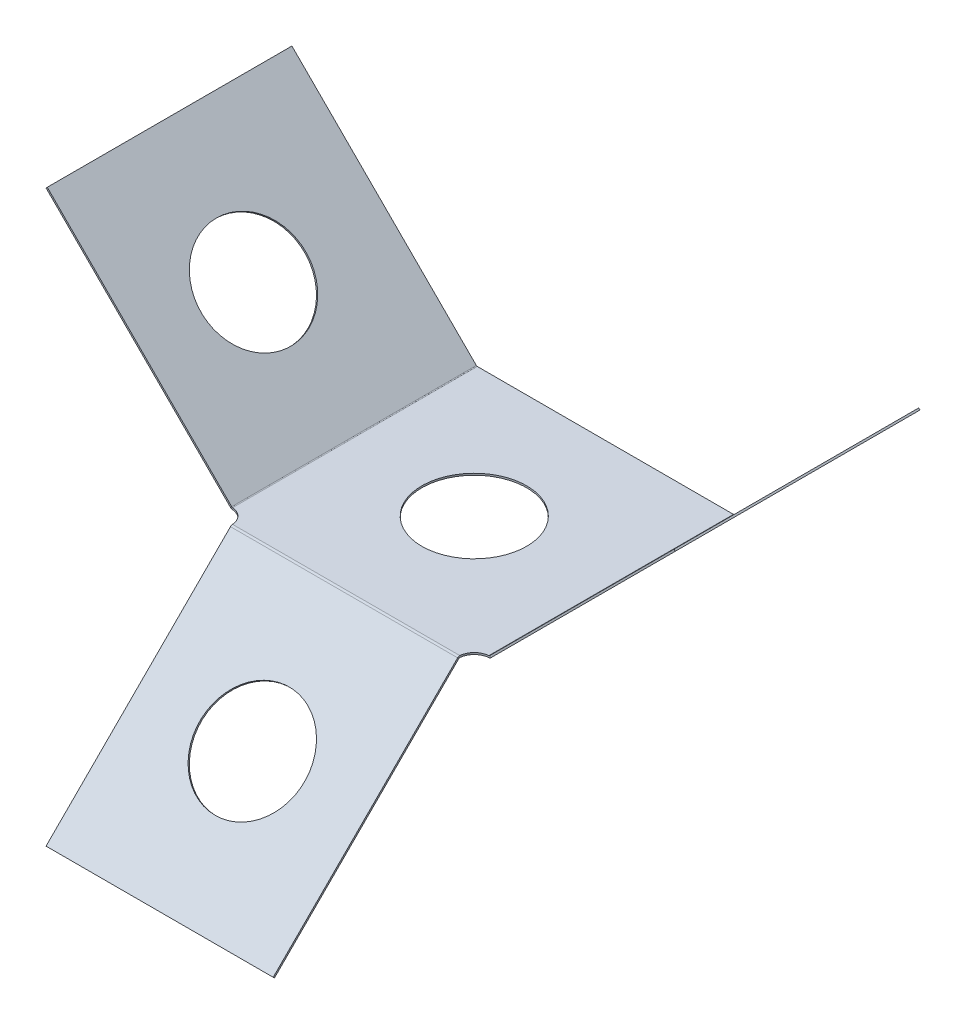
from build123d import *

# Parameters (mm, degrees)
SKETCH1_R            = 30
BASE_FLANGE1_DEPTH   = 1
EDGE_FLANGE1_START   = -75
EDGE_FLANGE1_DEPTH   = 140.5
EDGE_FLANGE1_START_2 = 65
EDGE_FLANGE1_2_DEPTH = 0.5
EDGE_FLANGE1_3_DEPTH = 140
SKETCH12_R           = 30
CUT_EXTRUDE1_DEPTH   = 10
EDGE_FLANGE2_START   = -65.5
EDGE_FLANGE2_DEPTH   = 131
EDGE_FLANGE2_2_DEPTH = 0.5
EDGE_FLANGE2_START_2 = 65
EDGE_FLANGE2_3_DEPTH = 0.5
EDGE_FLANGE2_START_3 = -65
EDGE_FLANGE2_4_DEPTH = 130
SKETCH16_R           = 30
CUT_EXTRUDE2_DEPTH   = 10
CUT_EXTRUDE3_DEPTH   = 10
FILLET2_R            = 9


# Read off the part's stored shape, not the designer's step: Edge-Flange1, Edge-Flange2
# Sheet-metal steps are written as plain solids
with BuildPart() as part:
    # Sketch1 → Base-Flange1 (new body)
    with BuildSketch(Plane(origin=(0, 0, 0), x_dir=(1, 0, 0), z_dir=(0, 1, 0))):
        with BuildLine():
            Line((-75, -65), (-75, 75))
            Line((-75, 75), (75, 75))
            Line((75, 75), (75, -65))
            ThreePointArc((75, -65), (72.071067812, -72.071067812), (65, -75))
            Line((65, -75), (-65, -75))
            ThreePointArc((-65, -75), (-72.071067812, -72.071067812), (-75, -65))
        make_face()
        with Locations(Location((0, 0, 0), (0, 0, 270))):
            Circle(SKETCH1_R, mode=Mode.SUBTRACT)
    extrude(amount=-BASE_FLANGE1_DEPTH)

    # Edge-Flange1 outline → Edge-Flange1 (cut)
    with BuildSketch(Plane.XY.offset(EDGE_FLANGE1_START)):
        with BuildLine():
            Line((-75, -1), (-73.279268401, -1))
            ThreePointArc((-73.279268401, -1), (-73.945137574, -0.867550387), (-74.509634201, -0.490365799))
            Line((-74.509634201, -0.490365799), (-75, 0))
            Line((-75, 0), (-75, -1))
        make_face()
        with BuildLine():
            ThreePointArc((74.509634201, -0.490365799), (73.945137574, -0.867550387), (73.279268401, -1))
            Line((73.279268401, -1), (75, -1))
            Line((75, -1), (75, 0))
            Line((75, 0), (74.509634201, -0.490365799))
        make_face()
    extrude(amount=EDGE_FLANGE1_DEPTH, mode=Mode.SUBTRACT)

    # Edge-Flange1 2 outline → Edge-Flange1 2 (cut)
    with BuildSketch(Plane.XY.offset(EDGE_FLANGE1_START_2)):
        with BuildLine():
            Line((-72.779268401, -1), (-72.779268401, 0))
            Line((-72.779268401, 0), (-75, 0))
            Line((-75, 0), (-74.509634201, -0.490365799))
            ThreePointArc((-74.509634201, -0.490365799), (-73.945137574, -0.867550387), (-73.279268401, -1))
            Line((-73.279268401, -1), (-72.779268401, -1))
        make_face()
        with BuildLine():
            Line((75, 0), (72.779268401, 0))
            Line((72.779268401, 0), (72.779268401, -1))
            Line((72.779268401, -1), (73.279268401, -1))
            ThreePointArc((73.279268401, -1), (73.945137574, -0.867550387), (74.509634201, -0.490365799))
            Line((74.509634201, -0.490365799), (75, 0))
        make_face()
    extrude(amount=EDGE_FLANGE1_2_DEPTH, mode=Mode.SUBTRACT)

    # Edge-Flange1 3 outline → Edge-Flange1 3 (add)
    with BuildSketch(Plane.XY.offset(EDGE_FLANGE1_START)):
        with BuildLine():
            Line((-75, 0), (-73.279268401, 0))
            ThreePointArc((-73.279268401, 0), (-73.562454141, 0.056329146), (-73.80252742, 0.216740982))
            Line((-73.80252742, 0.216740982), (-179.358910397, 105.773123959))
            Line((-179.358910397, 105.773123959), (-180.066017178, 105.066017178))
            Line((-180.066017178, 105.066017178), (-75, 0))
        make_face()
        with BuildLine():
            ThreePointArc((73.80252742, 0.216740982), (73.562454141, 0.056329146), (73.279268401, 0))
            Line((73.279268401, 0), (75, 0))
            Line((75, 0), (180.066017178, 105.066017178))
            Line((180.066017178, 105.066017178), (179.358910397, 105.773123959))
            Line((179.358910397, 105.773123959), (73.80252742, 0.216740982))
        make_face()
    extrude(amount=EDGE_FLANGE1_3_DEPTH)

    # Sketch12 → Cut-Extrude1 (cut)
    with BuildSketch(Plane(origin=(-36.792893219, -36.792893219, 0), x_dir=(0, 0, -1), z_dir=(0.7071067811865438, 0.7071067811865512, 0))):
        with Locations(Location((0, 126.618795027, 0), (0, 0, 90))):
            Circle(SKETCH12_R)
    cut_extrude1 = extrude(amount=-CUT_EXTRUDE1_DEPTH, mode=Mode.SUBTRACT)

    # Mirror1: Cut-Extrude1 across plane
    add(cut_extrude1.mirror(Plane(origin=(0, 0, 0), x_dir=(0, 0, 1), z_dir=(1, 0, 0))), mode=Mode.SUBTRACT)

    # Edge-Flange2 outline → Edge-Flange2 (cut)
    with BuildSketch(Plane.YZ.offset(EDGE_FLANGE2_START)):
        with BuildLine():
            ThreePointArc((-0.509634201, 74.509634201), (-0.132449613, 73.945137574), (0, 73.279268401))
            Line((0, 73.279268401), (0, 75))
            Line((0, 75), (-1, 75))
            Line((-1, 75), (-0.509634201, 74.509634201))
        make_face()
    extrude(amount=EDGE_FLANGE2_DEPTH, mode=Mode.SUBTRACT)

    # Edge-Flange2 2 outline → Edge-Flange2 2 (cut)
    with BuildSketch(Plane.YZ.offset(EDGE_FLANGE2_START)):
        with BuildLine():
            Line((-1, 72.779268401), (0, 72.779268401))
            Line((0, 72.779268401), (0, 73.279268401))
            ThreePointArc((0, 73.279268401), (-0.132449613, 73.945137574), (-0.509634201, 74.509634201))
            Line((-0.509634201, 74.509634201), (-1, 75))
            Line((-1, 75), (-1, 72.779268401))
        make_face()
    extrude(amount=EDGE_FLANGE2_2_DEPTH, mode=Mode.SUBTRACT)

    # Edge-Flange2 3 outline → Edge-Flange2 3 (cut)
    with BuildSketch(Plane.YZ.offset(EDGE_FLANGE2_START_2)):
        with BuildLine():
            Line((-1, 72.779268401), (0, 72.779268401))
            Line((0, 72.779268401), (0, 73.279268401))
            ThreePointArc((0, 73.279268401), (-0.132449613, 73.945137574), (-0.509634201, 74.509634201))
            Line((-0.509634201, 74.509634201), (-1, 75))
            Line((-1, 75), (-1, 72.779268401))
        make_face()
    extrude(amount=EDGE_FLANGE2_3_DEPTH, mode=Mode.SUBTRACT)

    # Edge-Flange2 4 outline → Edge-Flange2 4 (add)
    with BuildSketch(Plane.YZ.offset(EDGE_FLANGE2_START_3)):
        with BuildLine():
            ThreePointArc((-1.216740982, 73.80252742), (-1.056329146, 73.562454141), (-1, 73.279268401))
            Line((-1, 73.279268401), (-1, 75))
            Line((-1, 75), (-106.066017178, 180.066017178))
            Line((-106.066017178, 180.066017178), (-106.773123959, 179.358910397))
            Line((-106.773123959, 179.358910397), (-1.216740982, 73.80252742))
        make_face()
    extrude(amount=EDGE_FLANGE2_4_DEPTH)

    # Sketch16 → Cut-Extrude2 (cut)
    with BuildSketch(Plane(origin=(0, 37, 37), x_dir=(1, 0, 0), z_dir=(0, 0.7071067811865513, 0.7071067811865438))):
        with Locations(Location((0, -127.325901808, 0), (0, 0, 270))):
            Circle(SKETCH16_R)
    extrude(amount=-CUT_EXTRUDE2_DEPTH, mode=Mode.SUBTRACT)

    # Sketch17 → Cut-Extrude3 (cut)
    with BuildSketch(Plane(origin=(0, 0, 0), x_dir=(1, 0, 0), z_dir=(0, 1, 0))):
        Polygon((-72.779268401, -65), (-65, -65), (-65, -72.779268401), (-65.24665486, -73.060936269), (-65.339064279, -76.419683321), (-73.753182135, -79.834644684), (-76.575821569, -65.450165918), align=None)
    cut_extrude3 = extrude(amount=-CUT_EXTRUDE3_DEPTH, mode=Mode.SUBTRACT)

    # Mirror2: Cut-Extrude3 across plane
    add(cut_extrude3.mirror(Plane(origin=(0, 0, 0), x_dir=(0, 0, 1), z_dir=(1, 0, 0))), mode=Mode.SUBTRACT)

    # Fillet2
    fillet2_edges = [part.edges().sort_by_distance(p)[0] for p in [
        (-65, -0.5, 65),
    ]]
    fillet(fillet2_edges, radius=FILLET2_R)
    fillet2_2_edges = [part.edges().sort_by_distance(p)[0] for p in [
        (65, -0.5, 65),
    ]]
    fillet(fillet2_2_edges, radius=FILLET2_R)


solid = part.part
